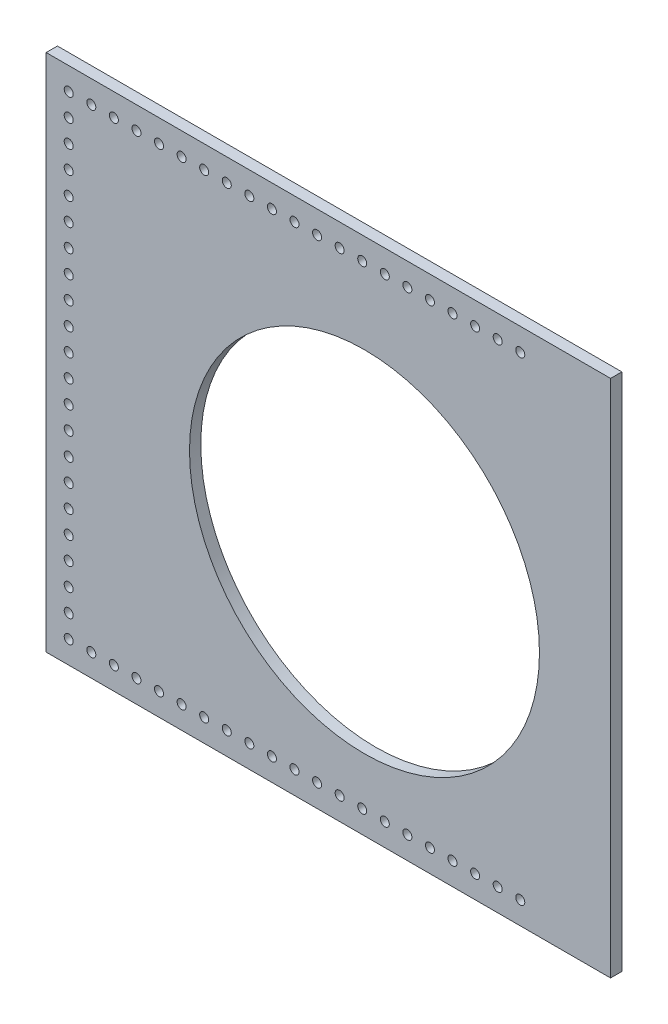
from build123d import *

# Parameters (mm, degrees)
SKETCH1_W           = 317.5
SKETCH1_H           = 292.1
SKETCH1_R           = 98.425
SKETCH1_R_2         = 2.54
BOSS_EXTRUDE1_DEPTH = 6.35


with BuildPart() as part:
    # Sketch1 → Boss-Extrude1 (new body)
    with BuildSketch(Plane.XY):
        with Locations((158.75, 146.05)):
            Rectangle(SKETCH1_W, SKETCH1_H)
        with Locations((179.07, 138.43)):
            Circle(SKETCH1_R, mode=Mode.SUBTRACT)
        with Locations((12.7, 279.4)):
            Circle(SKETCH1_R_2, mode=Mode.SUBTRACT)
        with Locations((25.4, 279.4)):
            Circle(SKETCH1_R_2, mode=Mode.SUBTRACT)
        with Locations((38.1, 279.4)):
            Circle(SKETCH1_R_2, mode=Mode.SUBTRACT)
        with Locations((50.8, 279.4)):
            Circle(SKETCH1_R_2, mode=Mode.SUBTRACT)
        with Locations((63.5, 279.4)):
            Circle(SKETCH1_R_2, mode=Mode.SUBTRACT)
        with Locations((76.2, 279.4)):
            Circle(SKETCH1_R_2, mode=Mode.SUBTRACT)
        with Locations((88.9, 279.4)):
            Circle(SKETCH1_R_2, mode=Mode.SUBTRACT)
        with Locations((101.6, 279.4)):
            Circle(SKETCH1_R_2, mode=Mode.SUBTRACT)
        with Locations((114.3, 279.4)):
            Circle(SKETCH1_R_2, mode=Mode.SUBTRACT)
        with Locations((127, 279.4)):
            Circle(SKETCH1_R_2, mode=Mode.SUBTRACT)
        with Locations((139.7, 279.4)):
            Circle(SKETCH1_R_2, mode=Mode.SUBTRACT)
        with Locations((152.4, 279.4)):
            Circle(SKETCH1_R_2, mode=Mode.SUBTRACT)
        with Locations((165.1, 279.4)):
            Circle(SKETCH1_R_2, mode=Mode.SUBTRACT)
        with Locations((177.8, 279.4)):
            Circle(SKETCH1_R_2, mode=Mode.SUBTRACT)
        with Locations((190.5, 279.4)):
            Circle(SKETCH1_R_2, mode=Mode.SUBTRACT)
        with Locations((203.2, 279.4)):
            Circle(SKETCH1_R_2, mode=Mode.SUBTRACT)
        with Locations((215.9, 279.4)):
            Circle(SKETCH1_R_2, mode=Mode.SUBTRACT)
        with Locations((228.6, 279.4)):
            Circle(SKETCH1_R_2, mode=Mode.SUBTRACT)
        with Locations((241.3, 279.4)):
            Circle(SKETCH1_R_2, mode=Mode.SUBTRACT)
        with Locations((254, 279.4)):
            Circle(SKETCH1_R_2, mode=Mode.SUBTRACT)
        with Locations((266.7, 279.4)):
            Circle(SKETCH1_R_2, mode=Mode.SUBTRACT)
        with Locations((12.7, 266.7)):
            Circle(SKETCH1_R_2, mode=Mode.SUBTRACT)
        with Locations((12.7, 254)):
            Circle(SKETCH1_R_2, mode=Mode.SUBTRACT)
        with Locations((12.7, 241.3)):
            Circle(SKETCH1_R_2, mode=Mode.SUBTRACT)
        with Locations((12.7, 228.6)):
            Circle(SKETCH1_R_2, mode=Mode.SUBTRACT)
        with Locations((12.7, 215.9)):
            Circle(SKETCH1_R_2, mode=Mode.SUBTRACT)
        with Locations((12.7, 203.2)):
            Circle(SKETCH1_R_2, mode=Mode.SUBTRACT)
        with Locations((12.7, 190.5)):
            Circle(SKETCH1_R_2, mode=Mode.SUBTRACT)
        with Locations((12.7, 177.8)):
            Circle(SKETCH1_R_2, mode=Mode.SUBTRACT)
        with Locations((12.7, 165.1)):
            Circle(SKETCH1_R_2, mode=Mode.SUBTRACT)
        with Locations((12.7, 152.4)):
            Circle(SKETCH1_R_2, mode=Mode.SUBTRACT)
        with Locations((12.7, 139.7)):
            Circle(SKETCH1_R_2, mode=Mode.SUBTRACT)
        with Locations((12.7, 127)):
            Circle(SKETCH1_R_2, mode=Mode.SUBTRACT)
        with Locations((12.7, 114.3)):
            Circle(SKETCH1_R_2, mode=Mode.SUBTRACT)
        with Locations((12.7, 101.6)):
            Circle(SKETCH1_R_2, mode=Mode.SUBTRACT)
        with Locations((12.7, 88.9)):
            Circle(SKETCH1_R_2, mode=Mode.SUBTRACT)
        with Locations((12.7, 76.2)):
            Circle(SKETCH1_R_2, mode=Mode.SUBTRACT)
        with Locations((12.7, 63.5)):
            Circle(SKETCH1_R_2, mode=Mode.SUBTRACT)
        with Locations((12.7, 50.8)):
            Circle(SKETCH1_R_2, mode=Mode.SUBTRACT)
        with Locations((12.7, 38.1)):
            Circle(SKETCH1_R_2, mode=Mode.SUBTRACT)
        with Locations((12.7, 25.4)):
            Circle(SKETCH1_R_2, mode=Mode.SUBTRACT)
        with Locations((12.7, 12.7)):
            Circle(SKETCH1_R_2, mode=Mode.SUBTRACT)
        with Locations((25.4, 12.7)):
            Circle(SKETCH1_R_2, mode=Mode.SUBTRACT)
        with Locations((38.1, 12.7)):
            Circle(SKETCH1_R_2, mode=Mode.SUBTRACT)
        with Locations((50.8, 12.7)):
            Circle(SKETCH1_R_2, mode=Mode.SUBTRACT)
        with Locations((63.5, 12.7)):
            Circle(SKETCH1_R_2, mode=Mode.SUBTRACT)
        with Locations((76.2, 12.7)):
            Circle(SKETCH1_R_2, mode=Mode.SUBTRACT)
        with Locations((88.9, 12.7)):
            Circle(SKETCH1_R_2, mode=Mode.SUBTRACT)
        with Locations((101.6, 12.7)):
            Circle(SKETCH1_R_2, mode=Mode.SUBTRACT)
        with Locations((114.3, 12.7)):
            Circle(SKETCH1_R_2, mode=Mode.SUBTRACT)
        with Locations((127, 12.7)):
            Circle(SKETCH1_R_2, mode=Mode.SUBTRACT)
        with Locations((139.7, 12.7)):
            Circle(SKETCH1_R_2, mode=Mode.SUBTRACT)
        with Locations((152.4, 12.7)):
            Circle(SKETCH1_R_2, mode=Mode.SUBTRACT)
        with Locations((165.1, 12.7)):
            Circle(SKETCH1_R_2, mode=Mode.SUBTRACT)
        with Locations((177.8, 12.7)):
            Circle(SKETCH1_R_2, mode=Mode.SUBTRACT)
        with Locations((190.5, 12.7)):
            Circle(SKETCH1_R_2, mode=Mode.SUBTRACT)
        with Locations((203.2, 12.7)):
            Circle(SKETCH1_R_2, mode=Mode.SUBTRACT)
        with Locations((215.9, 12.7)):
            Circle(SKETCH1_R_2, mode=Mode.SUBTRACT)
        with Locations((228.6, 12.7)):
            Circle(SKETCH1_R_2, mode=Mode.SUBTRACT)
        with Locations((241.3, 12.7)):
            Circle(SKETCH1_R_2, mode=Mode.SUBTRACT)
        with Locations((254, 12.7)):
            Circle(SKETCH1_R_2, mode=Mode.SUBTRACT)
        with Locations((266.7, 12.7)):
            Circle(SKETCH1_R_2, mode=Mode.SUBTRACT)
    extrude(amount=BOSS_EXTRUDE1_DEPTH)


solid = part.part
